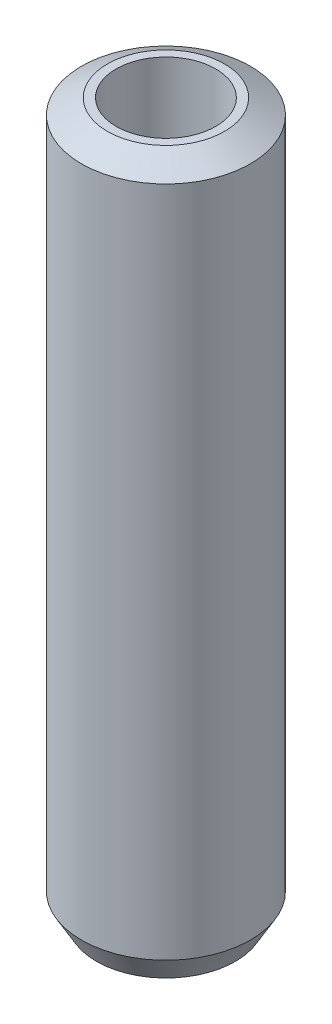
from build123d import *
from OCP.BRepFilletAPI import BRepFilletAPI_MakeChamfer

# Parameters (mm, degrees)
SKETCH1_R           = 20
BOSS_EXTRUDE1_DEPTH = 168.766630002
SKETCH2_R           = 11.791257899
CUT_EXTRUDE1_DEPTH  = 172.120353559
CHAMFER1_SIZE       = 3.55388026
CHAMFER1_SIZE2      = 6.155501174


with BuildPart() as part:
    # Sketch1 → Boss-Extrude1 (new body)
    with BuildSketch(Plane(origin=(0, 0, 0), x_dir=(1, 0, 0), z_dir=(0, 1, 0))):
        Circle(SKETCH1_R)
    extrude(amount=BOSS_EXTRUDE1_DEPTH)

    # Sketch2 → Cut-Extrude1 (cut, through all)
    with BuildSketch(Plane(origin=(0, 0, 0), x_dir=(1, 0, 0), z_dir=(0, 1, 0))):
        Circle(SKETCH2_R)
    extrude(amount=CUT_EXTRUDE1_DEPTH, mode=Mode.SUBTRACT)

    # Chamfer1: one chamfer whose edges measure the first distance from different faces: ONE call of the kernel's chamfer builder (chamfer() names one face for all edges)
    chamfer1_edges_1 = [part.edges().sort_by_distance(p)[0] for p in [
        (-20, 168.766630002, 0),
    ]]
    chamfer1_side_1 = [part.faces().sort_by_distance(p)[0] for p in [
        (-20, 84.383315001, 0),
    ]]
    chamfer1_edges_2 = [part.edges().sort_by_distance(p)[0] for p in [
        (-20, 0, 0),
    ]]
    chamfer1_side_2 = [part.faces().sort_by_distance(p)[0] for p in [
        (-19.434314575, 0, 0),
    ]]
    chamfer1 = BRepFilletAPI_MakeChamfer(part.part.solid().wrapped)
    for e in chamfer1_edges_1:
        chamfer1.Add(CHAMFER1_SIZE, CHAMFER1_SIZE2, e.wrapped, chamfer1_side_1[0].wrapped)  # the first distance lies on this face
    for e in chamfer1_edges_2:
        chamfer1.Add(CHAMFER1_SIZE, CHAMFER1_SIZE2, e.wrapped, chamfer1_side_2[0].wrapped)  # the first distance lies on this face
    add(Compound.cast(chamfer1.Shape()), mode=Mode.REPLACE)


solid = part.part
